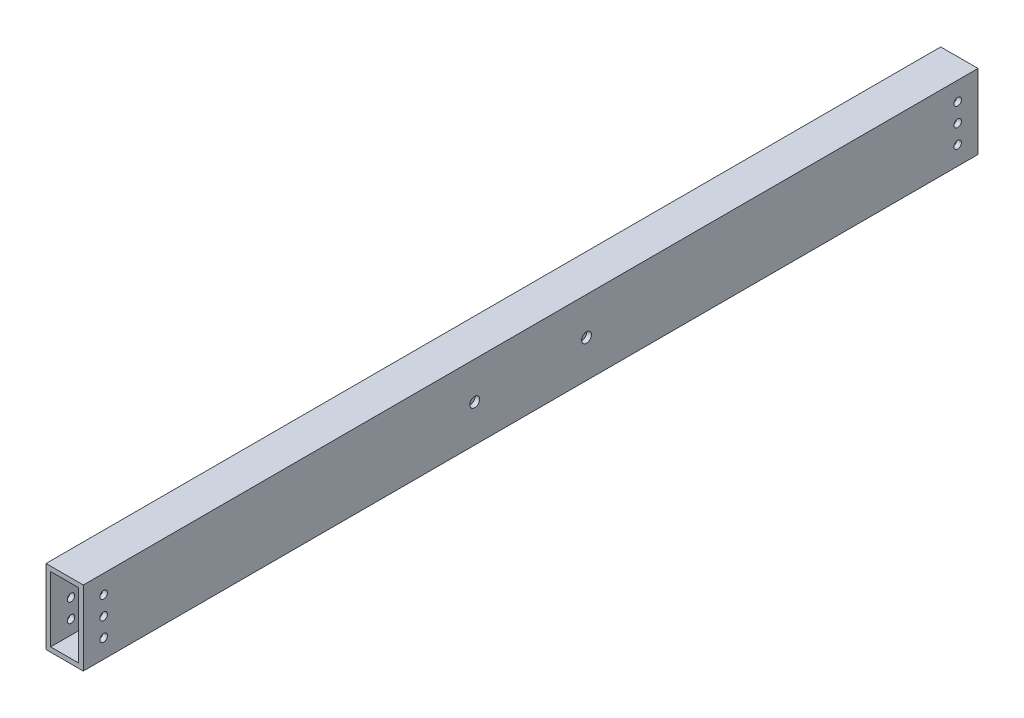
from build123d import *

# Parameters (mm, degrees)
SKETCH1_W               = 25.4
SKETCH1_H               = 50.8
SKETCH1_W_2             = 19.05
SKETCH1_H_2             = 44.45
BOSS_EXTRUDE1_DEPTH     = 304.8
F_10_CLEARANCE_HOLE1_D  = 5.1054
F_1_4_CLEARANCE_HOLE2_D = 6.7564


with BuildPart() as part:
    # Sketch1 → Boss-Extrude1 (new, symmetric)
    with BuildSketch(Plane.XY):
        Rectangle(SKETCH1_W, SKETCH1_H)
        Rectangle(SKETCH1_W_2, SKETCH1_H_2, mode=Mode.SUBTRACT)
    extrude(amount=BOSS_EXTRUDE1_DEPTH, both=True)

    # #10 Clearance Hole1 (through all)
    with Locations(Plane(origin=(12.7, 0, 0), x_dir=(0, 0, -1), z_dir=(1, 0, 0))):
        with Locations((-290.940864397, 12.7), (-290.940864397, 0), (-290.940864397, -12.7)):
            f_10_clearance_hole1 = Hole(F_10_CLEARANCE_HOLE1_D / 2)

    # Mirror1: #10 Clearance Hole1 across plane
    add(f_10_clearance_hole1.mirror(Plane.XY), mode=Mode.SUBTRACT)

    # 1/4 Clearance Hole2 (through all)
    with Locations(Plane(origin=(12.7, 0, 0), x_dir=(0, 0, -1), z_dir=(1, 0, 0))):
        with Locations((-38.1, 0), (38.1, 0)):
            Hole(F_1_4_CLEARANCE_HOLE2_D / 2)


solid = part.part
